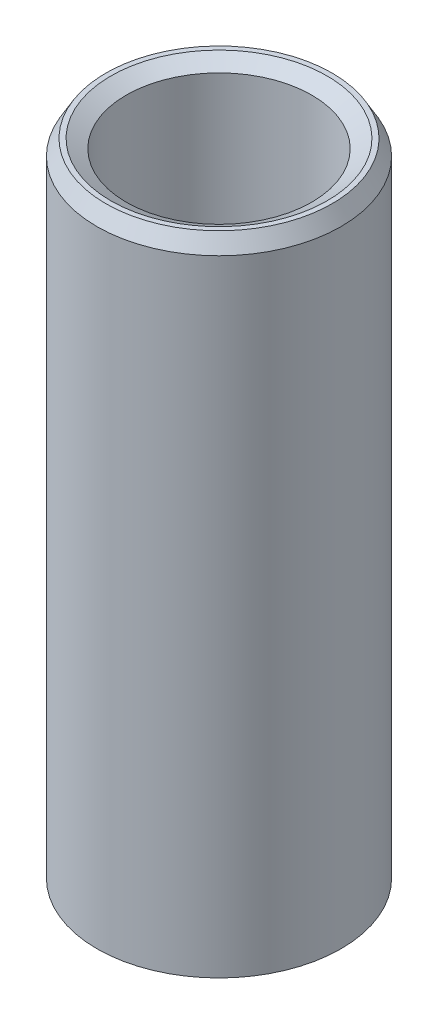
from build123d import *
from OCP.BRepFilletAPI import BRepFilletAPI_MakeChamfer

# Parameters (mm, degrees)
SKETCH1_R           = 30
BOSS_EXTRUDE1_DEPTH = 159.694758177
SKETCH2_R           = 22.807276447
CUT_EXTRUDE1_DEPTH  = 166.234426767
CHAMFER1_SIZE       = 3.779963618
CHAMFER1_SIZE2      = 2.182363012


with BuildPart() as part:
    # Sketch1 → Boss-Extrude1 (new body)
    with BuildSketch(Plane(origin=(0, 0, 0), x_dir=(1, 0, 0), z_dir=(0, 1, 0))):
        Circle(SKETCH1_R)
    extrude(amount=BOSS_EXTRUDE1_DEPTH)

    # Sketch2 → Cut-Extrude1 (cut, through all)
    with BuildSketch(Plane(origin=(0, 0, 0), x_dir=(1, 0, 0), z_dir=(0, 1, 0))):
        Circle(SKETCH2_R)
    extrude(amount=CUT_EXTRUDE1_DEPTH, mode=Mode.SUBTRACT)

    # Chamfer1: one chamfer whose edges measure the first distance from different faces: ONE call of the kernel's chamfer builder (chamfer() names one face for all edges)
    chamfer1_edges_1 = [part.edges().sort_by_distance(p)[0] for p in [
        (-22.807276447, 159.694758177, 0),
    ]]
    chamfer1_side_1 = [part.faces().sort_by_distance(p)[0] for p in [
        (-29.151471863, 159.694758177, 0),
    ]]
    chamfer1_edges_2 = [part.edges().sort_by_distance(p)[0] for p in [
        (-22.807276447, 0, 0),
    ]]
    chamfer1_side_2 = [part.faces().sort_by_distance(p)[0] for p in [
        (-22.807276447, 79.847379088, 0),
    ]]
    chamfer1_edges_3 = [part.edges().sort_by_distance(p)[0] for p in [
        (-30, 0, 0),
    ]]
    chamfer1_side_3 = [part.faces().sort_by_distance(p)[0] for p in [
        (-29.151471863, 0, 0),
    ]]
    chamfer1_edges_4 = [part.edges().sort_by_distance(p)[0] for p in [
        (-30, 159.694758177, 0),
    ]]
    chamfer1_side_4 = [part.faces().sort_by_distance(p)[0] for p in [
        (-30, 79.847379088, 0),
    ]]
    chamfer1 = BRepFilletAPI_MakeChamfer(part.part.solid().wrapped)
    for e in chamfer1_edges_1:
        chamfer1.Add(CHAMFER1_SIZE, CHAMFER1_SIZE2, e.wrapped, chamfer1_side_1[0].wrapped)  # the first distance lies on this face
    for e in chamfer1_edges_2:
        chamfer1.Add(CHAMFER1_SIZE, CHAMFER1_SIZE2, e.wrapped, chamfer1_side_2[0].wrapped)  # the first distance lies on this face
    for e in chamfer1_edges_3:
        chamfer1.Add(CHAMFER1_SIZE, CHAMFER1_SIZE2, e.wrapped, chamfer1_side_3[0].wrapped)  # the first distance lies on this face
    for e in chamfer1_edges_4:
        chamfer1.Add(CHAMFER1_SIZE, CHAMFER1_SIZE2, e.wrapped, chamfer1_side_4[0].wrapped)  # the first distance lies on this face
    add(Compound.cast(chamfer1.Shape()), mode=Mode.REPLACE)


solid = part.part
